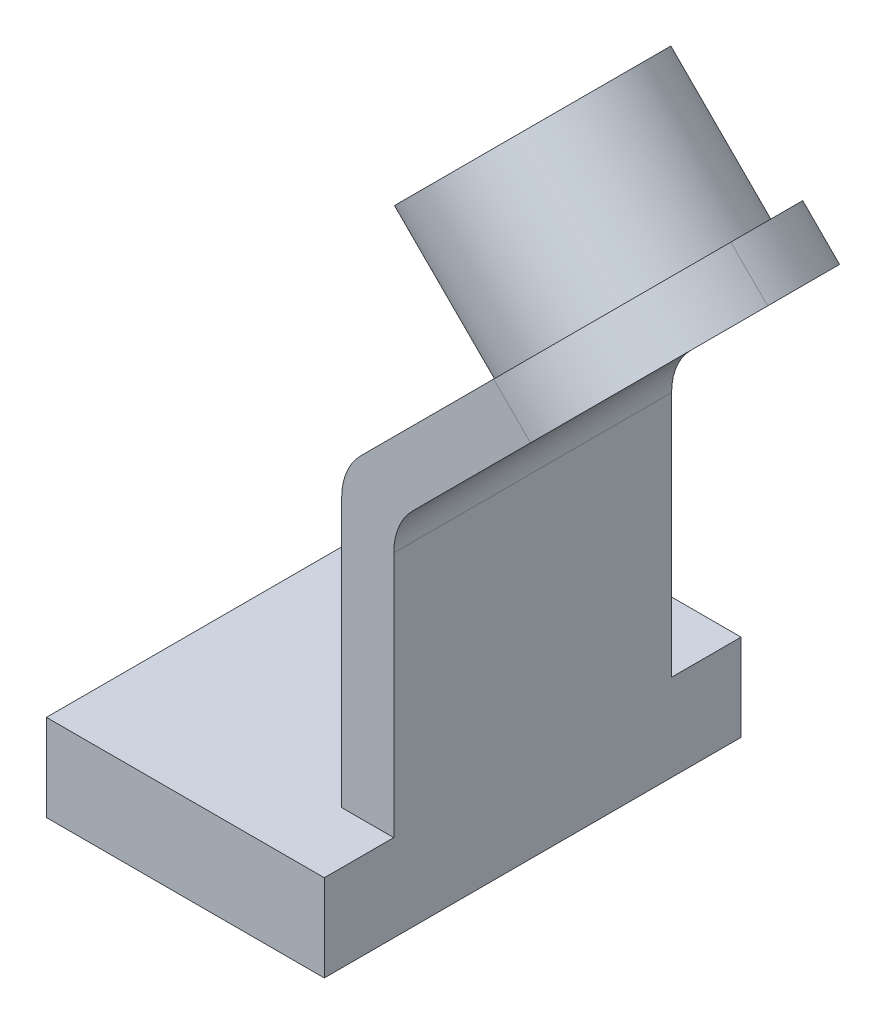
from build123d import *

# Parameters (mm, degrees)
SKETCH1_W           = 64
SKETCH1_H           = 20
BOSS_EXTRUDE1_DEPTH = 48
BOSS_EXTRUDE2_DEPTH = 32
FILLET2_R           = 32
FILLET3_R           = 15


with BuildPart() as part:
    # Sketch1 → Boss-Extrude1 (new, symmetric)
    with BuildSketch(Plane.XY):
        Rectangle(SKETCH1_W, SKETCH1_H)
    extrude(amount=BOSS_EXTRUDE1_DEPTH, both=True)

    # Sketch1<3> → Boss-Extrude2 (add, symmetric)
    with BuildSketch(Plane.XY):
        Polygon((20, 10), (32, 10), (32, 73), (86.127416998, 127.127416998), (77.642135624, 135.612698372), (73.399494937, 131.370057685), (66.328427125, 124.298989873), (55.014718626, 112.985281374), (20, 77.970562748), align=None)
    extrude(amount=BOSS_EXTRUDE2_DEPTH, both=True)

    # Fillet2
    fillet2_edges = [part.edges().sort_by_distance(p)[0] for p in [
        (81.884776311, 131.370057685, -32),
        (81.884776311, 131.370057685, 32),
    ]]
    fillet(fillet2_edges, radius=FILLET2_R - 0.0001)  # a hair under: the kernel refuses the full size

    # Fillet3
    fillet3_edges = [part.edges().sort_by_distance(p)[0] for p in [
        (32, 73, 0),
        (20, 77.970562748, 0),
    ]]
    fillet(fillet3_edges, radius=FILLET3_R)

    # Sketch1<5> one side → Revolve3 (revolve)
    with BuildSketch(Plane.XY, mode=Mode.PRIVATE) as revolve3_sk:
        Polygon((66.328427125, 124.298989873), (55.014718626, 112.985281374), (63.5, 104.5), (86.127416998, 127.127416998), (77.642135624, 135.612698372), (73.399494937, 131.370057685), align=None)
        Polygon((66.328427125, 124.298989873), (73.399494937, 131.370057685), (50.384776311, 154.384776311), (43.313708499, 147.313708499), align=None)
    revolve(revolve3_sk.sketch.rotate(Axis((32, 136, 0), (0.7071067811865483, -0.7071067811865467, 0)), 180), axis=Axis((32, 136, 0), (0.7071067811865483, -0.7071067811865467, 0)))


solid = part.part
